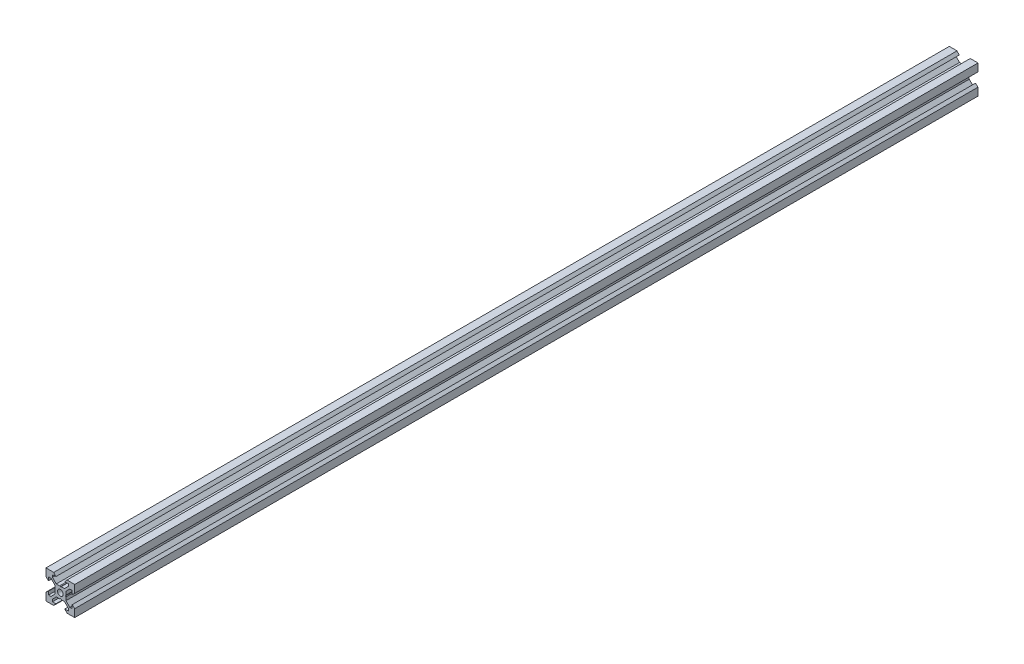
from build123d import *

# Parameters (mm, degrees)
SKETCH1_R           = 2
BOSS_EXTRUDE1_DEPTH = 314.575


with BuildPart() as part:
    # Sketch1 → Boss-Extrude1 (new, symmetric)
    with BuildSketch(Plane.XY):
        Polygon((10, 4.610379336), (10, 10), (4.610379336, 10), (3.1, 8.2), (5.5, 8.2), (5.5, 6.560660172), (2.839339828, 3.9), (0.519615242, 3.9), (0, 3.6), (-0.519615242, 3.9), (-2.839339828, 3.9), (-5.5, 6.560660172), (-5.5, 8.2), (-3.1, 8.2), (-4.610379336, 10), (-10, 10), (-10, 4.610379336), (-8.2, 3.1), (-8.2, 5.5), (-6.560660172, 5.5), (-3.9, 2.839339828), (-3.9, 0.519615242), (-3.6, 0), (-3.9, -0.519615242), (-3.9, -2.839339828), (-6.560660172, -5.5), (-8.2, -5.5), (-8.2, -3.1), (-10, -4.610379336), (-10, -10), (-4.610379336, -10), (-3.1, -8.2), (-5.5, -8.2), (-5.5, -6.560660172), (-2.839339828, -3.9), (-0.519615242, -3.9), (0, -3.6), (0.519615242, -3.9), (2.839339828, -3.9), (5.5, -6.560660172), (5.5, -8.2), (3.1, -8.2), (4.610379336, -10), (10, -10), (10, -4.610379336), (8.2, -3.1), (8.2, -5.5), (6.560660172, -5.5), (3.9, -2.839339828), (3.9, -0.519615242), (3.6, 0), (3.9, 0.519615242), (3.9, 2.839339828), (6.560660172, 5.5), (8.2, 5.5), (8.2, 3.1), align=None)
        Circle(SKETCH1_R, mode=Mode.SUBTRACT)
    extrude(amount=BOSS_EXTRUDE1_DEPTH, both=True)


solid = part.part
